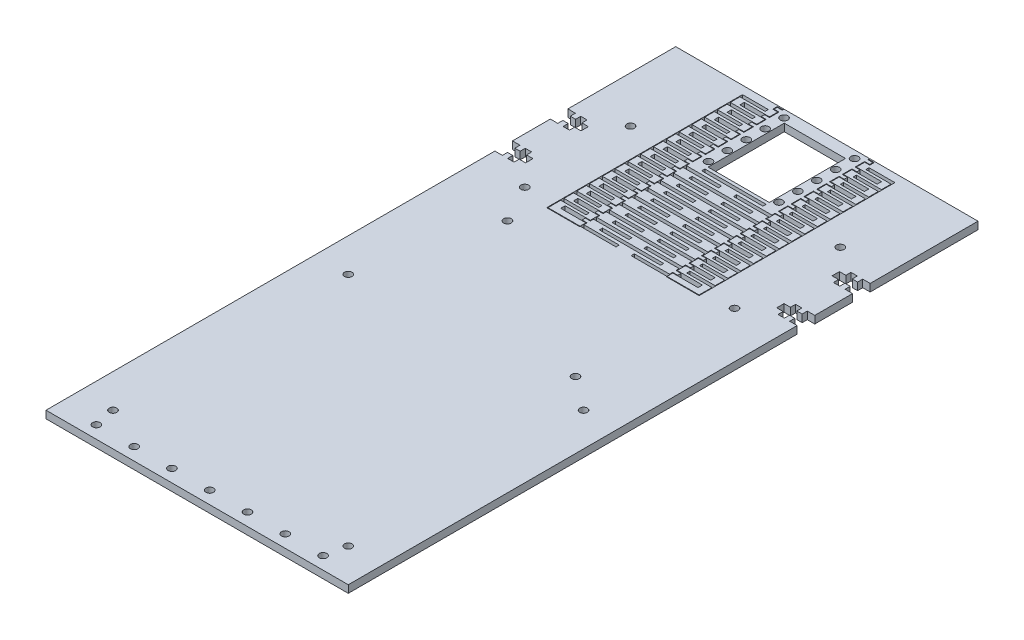
from build123d import *

# Parameters (mm, degrees)
SKETCH1_R           = 1.5
BOSS_EXTRUDE1_DEPTH = 2.9718
SKETCH2_W           = 24.3
SKETCH2_H           = 30.25
SKETCH2_H_2         = 1.27
SKETCH2_R           = 1.5
CUT_EXTRUDE2_DEPTH  = 10


with BuildPart() as part:
    # Sketch1 → Boss-Extrude1 (new body)
    with BuildSketch(Plane(origin=(0, 0, 0), x_dir=(1, 0, 0), z_dir=(0, 1, 0))):
        Polygon((60, 250), (-60, 250), (-60, 207.1925), (-57.0282, 207.1925), (-57.0282, 205.1605), (-54.92, 205.1605), (-54.92, 207.1925), (-52.38, 207.1925), (-52.38, 205.1605), (-49.84, 205.1605), (-49.84, 202.2395), (-52.38, 202.2395), (-52.38, 200.2075), (-54.92, 200.2075), (-54.92, 202.2395), (-57.0282, 202.2395), (-57.0282, 200.2075), (-60, 200.2075), (-60, 185.1925), (-57.0282, 185.1925), (-57.0282, 183.1605), (-54.92, 183.1605), (-54.92, 185.1925), (-52.38, 185.1925), (-52.38, 183.1605), (-49.84, 183.1605), (-49.84, 180.2395), (-52.38, 180.2395), (-52.38, 178.2075), (-54.92, 178.2075), (-54.92, 180.2395), (-57.0282, 180.2395), (-57.0282, 178.2075), (-60, 178.2075), (-60, 0), (60, 0), (60, 178.2075), (57.0282, 178.2075), (57.0282, 180.2395), (54.92, 180.2395), (54.92, 178.2075), (52.38, 178.2075), (52.38, 180.2395), (49.84, 180.2395), (49.84, 183.1605), (52.38, 183.1605), (52.38, 185.1925), (54.92, 185.1925), (54.92, 183.1605), (57.0282, 183.1605), (57.0282, 185.1925), (60, 185.1925), (60, 200.2075), (57.0282, 200.2075), (57.0282, 202.2395), (54.92, 202.2395), (54.92, 200.2075), (52.38, 200.2075), (52.38, 202.2395), (49.84, 202.2395), (49.84, 205.1605), (52.38, 205.1605), (52.38, 207.1925), (54.92, 207.1925), (54.92, 205.1605), (57.0282, 205.1605), (57.0282, 207.1925), (60, 207.1925), align=None)
        with Locations((-46.7, 13.3)):
            Circle(SKETCH1_R, mode=Mode.SUBTRACT)
        with Locations((-45, 5)):
            Circle(SKETCH1_R, mode=Mode.SUBTRACT)
        with Locations((-30, 5)):
            Circle(SKETCH1_R, mode=Mode.SUBTRACT)
        with Locations((-15, 5)):
            Circle(SKETCH1_R, mode=Mode.SUBTRACT)
        with Locations((-46.7, 106.7)):
            Circle(SKETCH1_R, mode=Mode.SUBTRACT)
        with Locations((0, 5)):
            Circle(SKETCH1_R, mode=Mode.SUBTRACT)
        with Locations((15, 5)):
            Circle(SKETCH1_R, mode=Mode.SUBTRACT)
        with Locations((30, 5)):
            Circle(SKETCH1_R, mode=Mode.SUBTRACT)
        with Locations((45, 5)):
            Circle(SKETCH1_R, mode=Mode.SUBTRACT)
        with Locations((46.7, 13.3)):
            Circle(SKETCH1_R, mode=Mode.SUBTRACT)
        with Locations((33.5, 116.7)):
            Circle(SKETCH1_R, mode=Mode.SUBTRACT)
        with Locations((46.7, 106.7)):
            Circle(SKETCH1_R, mode=Mode.SUBTRACT)
        with Locations((-41.6382, 171.7)):
            Circle(SKETCH1_R, mode=Mode.SUBTRACT)
        with Locations((-33.5, 156.7)):
            Circle(SKETCH1_R, mode=Mode.SUBTRACT)
        with Locations((-41.6382, 213.7)):
            Circle(SKETCH1_R, mode=Mode.SUBTRACT)
        with Locations((41.6382, 171.7)):
            Circle(SKETCH1_R, mode=Mode.SUBTRACT)
        with Locations((41.6382, 213.7)):
            Circle(SKETCH1_R, mode=Mode.SUBTRACT)
    extrude(amount=BOSS_EXTRUDE1_DEPTH)

    # Sketch2 → Cut-Extrude2 (cut)
    with BuildSketch(Plane(origin=(0, 2.9718, 0), x_dir=(1, 0, 0), z_dir=(0, 1, 0))):
        Polygon((-17, 249.29), (-17, 250), (-17.25, 250), (-17.25, 249.54), (-19.25, 249.54), (-19.25, 247.77), (-17.25, 247.77), (-17.25, 244.46), (-27.25, 244.46), (-27.25, 242.69), (-17.25, 242.69), (-17.25, 239.38), (-27.25, 239.38), (-27.25, 237.61), (-17.25, 237.61), (-17.25, 234.3), (-27.25, 234.3), (-27.25, 232.53), (-17.25, 232.53), (-17.25, 229.22), (-27.25, 229.22), (-27.25, 227.45), (-17.25, 227.45), (-17.25, 224.14), (-27.25, 224.14), (-27.25, 222.37), (-17.25, 222.37), (-17.25, 219.06), (-27.25, 219.06), (-27.25, 217.29), (-17.25, 217.29), (-17.25, 213.98), (-27.25, 213.98), (-27.25, 212.21), (-17.25, 212.21), (-17.25, 208.9), (-27.25, 208.9), (-27.25, 207.13), (-17.25, 207.13), (-17.25, 203.82), (-27.25, 203.82), (-27.25, 202.05), (-17.25, 202.05), (-17.25, 198.74), (-27.25, 198.74), (-27.25, 196.97), (-17.25, 196.97), (-17.25, 193.66), (-27.25, 193.66), (-27.25, 191.89), (-17.25, 191.89), (-17.25, 188.58), (-27.25, 188.58), (-27.25, 186.81), (-17.25, 186.81), (-17.25, 183.5), (-27.25, 183.5), (-27.25, 181.73), (-17.25, 181.73), (-17.25, 178.42), (-27.25, 178.42), (-27.25, 176.65), (-17.25, 176.65), (-17.25, 173.34), (-27.25, 173.34), (-27.25, 171.57), (-17.25, 171.57), (-17.25, 169.28), (-30, 169.28), (-30, 174.36), (-20, 174.36), (-20, 175.63), (-30, 175.63), (-30, 179.44), (-20, 179.44), (-20, 180.71), (-30, 180.71), (-30, 184.52), (-20, 184.52), (-20, 185.79), (-30, 185.79), (-30, 189.6), (-20, 189.6), (-20, 190.87), (-30, 190.87), (-30, 194.68), (-20, 194.68), (-20, 195.95), (-30, 195.95), (-30, 199.76), (-20, 199.76), (-20, 201.03), (-30, 201.03), (-30, 204.84), (-20, 204.84), (-20, 206.11), (-30, 206.11), (-30, 209.92), (-20, 209.92), (-20, 211.19), (-30, 211.19), (-30, 215), (-20, 215), (-20, 216.27), (-30, 216.27), (-30, 220.08), (-20, 220.08), (-20, 221.35), (-30, 221.35), (-30, 225.16), (-20, 225.16), (-20, 226.43), (-30, 226.43), (-30, 230.24), (-20, 230.24), (-20, 231.51), (-30, 231.51), (-30, 235.32), (-20, 235.32), (-20, 236.59), (-30, 236.59), (-30, 240.4), (-20, 240.4), (-20, 241.67), (-30, 241.67), (-30, 245.48), (-20, 245.48), (-20, 246.75), (-30.25, 246.75), (-30.25, 174.61), (-30.25, 169.03), (-17.25, 169.03), (-17, 169.28), (-3, 169.28), (-3, 170.55), (-17, 170.55), (-17, 171.82), (-19, 171.82), (-19, 173.09), (-17, 173.09), (-17, 174.36), (-3, 174.36), (-3, 175.63), (-17, 175.63), (-17, 176.9), (-19, 176.9), (-19, 178.17), (-17, 178.17), (-17, 179.44), (-3, 179.44), (-3, 180.71), (-17, 180.71), (-17, 181.98), (-19, 181.98), (-19, 183.25), (-17, 183.25), (-17, 184.52), (-3, 184.52), (-3, 185.79), (-17, 185.79), (-17, 187.06), (-19, 187.06), (-19, 188.33), (-17, 188.33), (-17, 189.6), (-3, 189.6), (-3, 190.87), (-17, 190.87), (-17, 192.14), (-19, 192.14), (-19, 193.41), (-17, 193.41), (-17, 194.68), (-3, 194.68), (-3, 195.95), (-17, 195.95), (-17, 197.22), (-19, 197.22), (-19, 198.49), (-17, 198.49), (-17, 199.76), (-3, 199.76), (-3, 201.03), (-17, 201.03), (-17, 202.3), (-19, 202.3), (-19, 203.57), (-17, 203.57), (-17, 204.84), (-3, 204.84), (-3, 206.11), (-17, 206.11), (-17, 207.38), (-19, 207.38), (-19, 208.65), (-17, 208.65), (-17, 209.92), (-3, 209.92), (-3, 211.19), (-17, 211.19), (-17, 212.46), (-19, 212.46), (-19, 213.73), (-17, 213.73), (-17, 217.54), (-19, 217.54), (-19, 218.81), (-17, 218.81), (-17, 222.62), (-19, 222.62), (-19, 223.89), (-17, 223.89), (-17, 227.7), (-19, 227.7), (-19, 228.97), (-17, 228.97), (-17, 232.78), (-19, 232.78), (-19, 234.05), (-17, 234.05), (-17, 237.86), (-19, 237.86), (-19, 239.13), (-17, 239.13), (-17, 242.94), (-19, 242.94), (-19, 244.21), (-17, 244.21), (-17, 248.02), (-19, 248.02), (-19, 249.29), align=None)
        Polygon((17.25, 250), (17, 250), (17, 249.29), (19, 249.29), (19, 248.02), (17, 248.02), (17, 244.21), (19, 244.21), (19, 242.94), (17, 242.94), (17, 239.13), (19, 239.13), (19, 237.86), (17, 237.86), (17, 234.05), (19, 234.05), (19, 232.78), (17, 232.78), (17, 228.97), (19, 228.97), (19, 227.7), (17, 227.7), (17, 223.89), (19, 223.89), (19, 222.62), (17, 222.62), (17, 218.81), (19, 218.81), (19, 217.54), (17, 217.54), (17, 213.73), (19, 213.73), (19, 212.46), (17, 212.46), (17, 211.19), (3, 211.19), (3, 209.92), (17, 209.92), (17, 208.65), (19, 208.65), (19, 207.38), (17, 207.38), (17, 206.11), (3, 206.11), (3, 204.84), (17, 204.84), (17, 203.57), (19, 203.57), (19, 202.3), (17, 202.3), (17, 201.03), (3, 201.03), (3, 199.76), (17, 199.76), (17, 198.49), (19, 198.49), (19, 197.22), (17, 197.22), (17, 195.95), (3, 195.95), (3, 194.68), (17, 194.68), (17, 193.41), (19, 193.41), (19, 192.14), (17, 192.14), (17, 190.87), (3, 190.87), (3, 189.6), (17, 189.6), (17, 188.33), (19, 188.33), (19, 187.06), (17, 187.06), (17, 185.79), (3, 185.79), (3, 184.52), (17, 184.52), (17, 183.25), (19, 183.25), (19, 181.98), (17, 181.98), (17, 180.71), (3, 180.71), (3, 179.44), (17, 179.44), (17, 178.17), (19, 178.17), (19, 176.9), (17, 176.9), (17, 175.63), (3, 175.63), (3, 174.36), (17, 174.36), (17, 173.09), (19, 173.09), (19, 171.82), (17, 171.82), (17, 170.55), (3, 170.55), (3, 169.28), (17.25, 169.28), (17.25, 171.57), (19.25, 171.57), (19.25, 173.34), (17.25, 173.34), (17.25, 176.65), (19.25, 176.65), (19.25, 178.42), (17.25, 178.42), (17.25, 181.73), (19.25, 181.73), (19.25, 183.5), (17.25, 183.5), (17.25, 186.81), (19.25, 186.81), (19.25, 188.58), (17.25, 188.58), (17.25, 191.89), (19.25, 191.89), (19.25, 193.66), (17.25, 193.66), (17.25, 196.97), (19.25, 196.97), (19.25, 198.74), (17.25, 198.74), (17.25, 202.05), (19.25, 202.05), (19.25, 203.82), (17.25, 203.82), (17.25, 207.13), (19.25, 207.13), (19.25, 208.9), (17.25, 208.9), (17.25, 212.21), (19.25, 212.21), (19.25, 213.98), (17.25, 213.98), (17.25, 217.29), (19.25, 217.29), (19.25, 219.06), (17.25, 219.06), (17.25, 222.37), (19.25, 222.37), (19.25, 224.14), (17.25, 224.14), (17.25, 227.45), (19.25, 227.45), (19.25, 229.22), (17.25, 229.22), (17.25, 232.53), (19.25, 232.53), (19.25, 234.3), (17.25, 234.3), (17.25, 237.61), (19.25, 237.61), (19.25, 239.38), (17.25, 239.38), (17.25, 242.69), (19.25, 242.69), (19.25, 244.46), (17.25, 244.46), (17.25, 247.77), (19.25, 247.77), (19.25, 249.54), (17.25, 249.54), align=None)
        with Locations((0, 230.125)):
            Rectangle(SKETCH2_W, SKETCH2_H)
        with Locations((0, 213.095)):
            Rectangle(SKETCH2_W, SKETCH2_H_2)
        with Locations((0, 208.015)):
            Rectangle(SKETCH2_W, SKETCH2_H_2)
        with Locations((0, 202.935)):
            Rectangle(SKETCH2_W, SKETCH2_H_2)
        with Locations((0, 197.855)):
            Rectangle(SKETCH2_W, SKETCH2_H_2)
        with Locations((0, 192.775)):
            Rectangle(SKETCH2_W, SKETCH2_H_2)
        with Locations((0, 187.695)):
            Rectangle(SKETCH2_W, SKETCH2_H_2)
        with Locations((0, 182.615)):
            Rectangle(SKETCH2_W, SKETCH2_H_2)
        with Locations((0, 177.535)):
            Rectangle(SKETCH2_W, SKETCH2_H_2)
        with Locations((0, 172.455)):
            Rectangle(SKETCH2_W, SKETCH2_H_2)
        with Locations((-14, 247)):
            Circle(SKETCH2_R)
        with Locations((-14, 239.5)):
            Circle(SKETCH2_R)
        with Locations((-14, 232)):
            Circle(SKETCH2_R)
        with Locations((-14, 224.5)):
            Circle(SKETCH2_R)
        with Locations((-14, 217)):
            Circle(SKETCH2_R)
    cut_extrude2 = extrude(amount=-CUT_EXTRUDE2_DEPTH, mode=Mode.SUBTRACT)

    # Mirror1: Cut-Extrude2 across plane
    add(cut_extrude2.mirror(Plane(origin=(0, 0, 0), x_dir=(0, 0, 1), z_dir=(1, 0, 0))), mode=Mode.SUBTRACT)


solid = part.part
